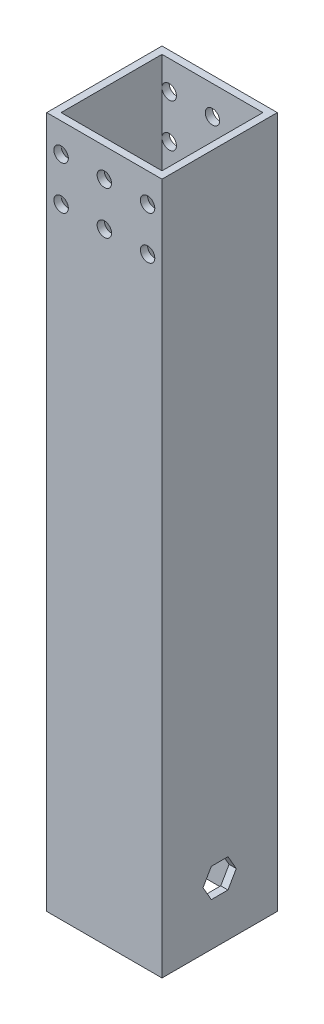
from build123d import *

# Parameters (mm, degrees)
SKETCH1_W            = 50.8
SKETCH1_H            = 50.8
SKETCH1_W_2          = 44.45
SKETCH1_H_2          = 44.45
BOSS_EXTRUDE1_DEPTH  = 304.8
SKETCH2_R            = 3.175
CUT_EXTRUDE1_DEPTH   = 101.6
LPATTERN1_COUNT      = 3
LPATTERN1_PITCH      = 19.05
LPATTERN1_COUNT_DIR2 = 2
LPATTERN1_PITCH_DIR2 = 19.05
CUT_EXTRUDE2_DEPTH   = 311.04651264


with BuildPart() as part:
    # Sketch1 → Boss-Extrude1 (new body)
    with BuildSketch(Plane(origin=(0, 0, 0), x_dir=(1, 0, 0), z_dir=(0, 1, 0))):
        Rectangle(SKETCH1_W, SKETCH1_H)
        Rectangle(SKETCH1_W_2, SKETCH1_H_2, mode=Mode.SUBTRACT)
    extrude(amount=BOSS_EXTRUDE1_DEPTH)

    # Sketch2 → Cut-Extrude1 (cut)
    with BuildSketch(Plane.XY.offset(25.4)):
        with Locations((-19.05, 292.1)):
            Circle(SKETCH2_R)
    cut_extrude1 = extrude(amount=-CUT_EXTRUDE1_DEPTH, mode=Mode.SUBTRACT)

    # LPattern1: Cut-Extrude1 3 × 2
    with Locations(*[(i * LPATTERN1_PITCH, -j * LPATTERN1_PITCH_DIR2, 0) for i in range(LPATTERN1_COUNT) for j in range(LPATTERN1_COUNT_DIR2) if (i, j) != (0, 0)]):
        add(cut_extrude1, mode=Mode.SUBTRACT)

    # Sketch3 → Cut-Extrude2 (cut, through all)
    with BuildSketch(Plane(origin=(25.4, 0, 0), x_dir=(0, 0, -1), z_dir=(1, 0, 0))):
        Polygon((-3.666174209, 19.05), (3.666174209, 19.05), (7.332348419, 25.4), (3.666174209, 31.75), (-3.666174209, 31.75), (-7.332348419, 25.4), align=None)
    extrude(amount=-CUT_EXTRUDE2_DEPTH, mode=Mode.SUBTRACT)


solid = part.part
